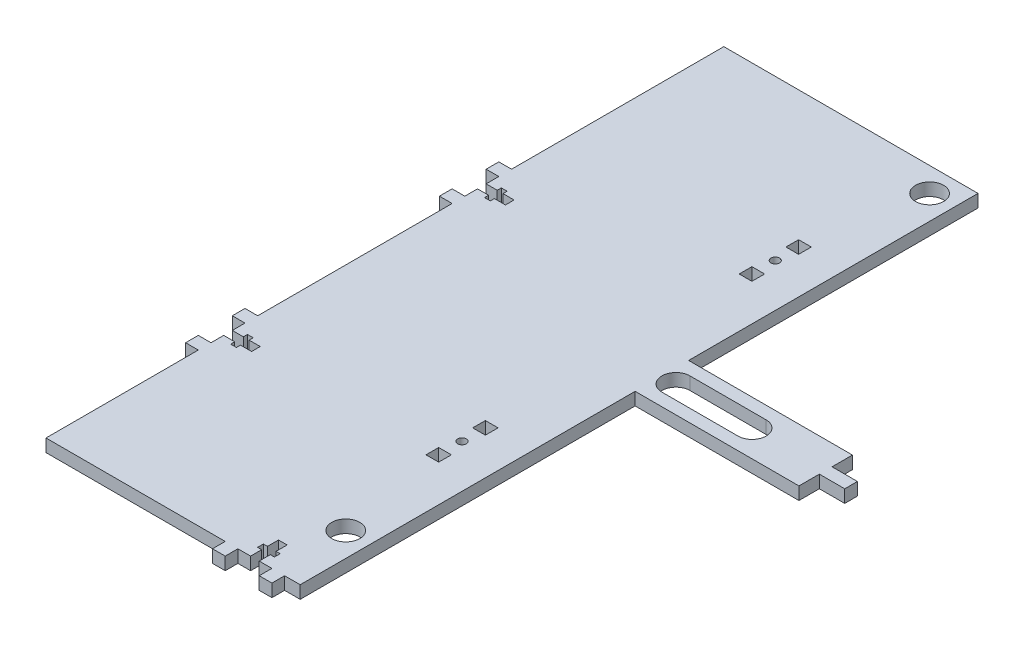
from build123d import *

# Parameters (mm, degrees)
AXLE_SUPPORT_PLATE_W   = 6.35
AXLE_SUPPORT_PLATE_H   = 6.35
AXLE_SUPPORT_PLATE_R   = 2.159
AXLE_SUPPORT_PLATE_R_2 = 7.030128061
BOSS_EXTRUDE1_DEPTH    = 6.35


with BuildPart() as part:
    # Axle Support Plate → Boss-Extrude1 (new body)
    with BuildSketch(Plane(origin=(0, 0, 0), x_dir=(1, 0, 0), z_dir=(0, 1, 0))):
        Polygon((55.79393597, -169.56756403), (63.58606403, -169.56756403), (63.58606403, -1.972692091), (145.546192091, -1.972692091), (145.546192091, 8.23243597), (158.246192091, 8.23243597), (158.246192091, 14.58243597), (145.546192091, 14.58243597), (145.546192091, 24.78756403), (63.58606403, 24.78756403), (63.58606403, 169.56756403), (-63.58606403, 169.56756403), (-63.58606403, 63.35043597), (-69.93606403, 63.35043597), (-69.93606403, 57.00043597), (-63.58606403, 57.00043597), (-63.58606403, 50.65043597), (-58.051064051, 50.65043597), (-58.051064051, 52.691435952), (-55.151064009, 52.691435952), (-55.151064009, 50.65043597), (-49.61606403, 50.65043597), (-49.61606403, 46.33243597), (-55.151064009, 46.33243597), (-55.151064009, 44.291435988), (-58.051064051, 44.291435988), (-58.051064051, 46.33243597), (-63.58606403, 46.33243597), (-63.58606403, 39.98243597), (-69.93606403, 39.98243597), (-69.93606403, 33.63243597), (-63.58606403, 33.63243597), (-63.58606403, -63.64956403), (-69.93606403, -63.64956403), (-69.93606403, -69.99956403), (-63.58606403, -69.99956403), (-63.58606403, -76.34956403), (-58.051064051, -76.34956403), (-58.051064051, -74.308564048), (-55.151064009, -74.308564048), (-55.151064009, -76.34956403), (-49.61606403, -76.34956403), (-49.61606403, -80.66756403), (-55.151064009, -80.66756403), (-55.151064009, -82.708564012), (-58.051064051, -82.708564012), (-58.051064051, -80.66756403), (-63.58606403, -80.66756403), (-63.58606403, -87.01756403), (-69.93606403, -87.01756403), (-69.93606403, -93.36756403), (-63.58606403, -93.36756403), (-63.58606403, -169.56756403), (26.07593597, -169.56756403), (26.07593597, -175.91756403), (32.42593597, -175.91756403), (32.42593597, -169.56756403), (38.77593597, -169.56756403), (38.77593597, -164.032564051), (36.734935988, -164.032564051), (36.734935988, -161.132564009), (38.77593597, -161.132564009), (38.77593597, -155.59756403), (43.09393597, -155.59756403), (43.09393597, -161.132564009), (45.134935952, -161.132564009), (45.134935952, -164.032564051), (43.09393597, -164.032564051), (43.09393597, -169.56756403), (49.44393597, -169.56756403), (49.44393597, -175.91756403), (55.79393597, -175.91756403), align=None)
        with Locations((41.95093597, -78.63556403)):
            Rectangle(AXLE_SUPPORT_PLATE_W, AXLE_SUPPORT_PLATE_H, mode=Mode.SUBTRACT)
        with Locations((41.95093597, -66.95156403)):
            Circle(AXLE_SUPPORT_PLATE_R, mode=Mode.SUBTRACT)
        with Locations((41.95093597, -55.26756403)):
            Rectangle(AXLE_SUPPORT_PLATE_W, AXLE_SUPPORT_PLATE_H, mode=Mode.SUBTRACT)
        with Locations((51.47593597, -134.64256403)):
            Circle(AXLE_SUPPORT_PLATE_R_2, mode=Mode.SUBTRACT)
        with Locations((41.95093597, 78.08243597)):
            Rectangle(AXLE_SUPPORT_PLATE_W, AXLE_SUPPORT_PLATE_H, mode=Mode.SUBTRACT)
        with Locations((41.95093597, 89.76643597)):
            Circle(AXLE_SUPPORT_PLATE_R, mode=Mode.SUBTRACT)
        with Locations((41.95093597, 101.45043597)):
            Rectangle(AXLE_SUPPORT_PLATE_W, AXLE_SUPPORT_PLATE_H, mode=Mode.SUBTRACT)
        with BuildLine():
            ThreePointArc((70.616192091, 4.377307909), (63.58606403, 11.40743597), (70.616192091, 18.43756403))
            Line((70.616192091, 18.43756403), (108.716192091, 18.43756403))
            ThreePointArc((108.716192091, 18.43756403), (115.746320151, 11.40743597), (108.716192091, 4.377307909))
            Line((108.716192091, 4.377307909), (70.616192091, 4.377307909))
        make_face(mode=Mode.SUBTRACT)
        with Locations((51.47593597, 157.45743597)):
            Circle(AXLE_SUPPORT_PLATE_R_2, mode=Mode.SUBTRACT)
    extrude(amount=BOSS_EXTRUDE1_DEPTH)


solid = part.part
